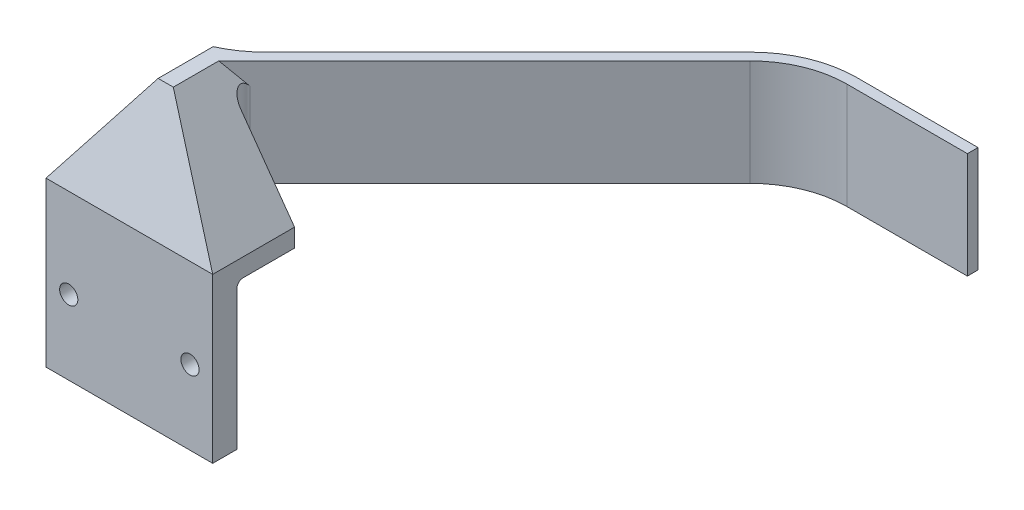
from build123d import *

# Parameters (mm, degrees)
SKETCH1_W           = 55
SKETCH1_H           = 48
SKETCH1_R           = 3
BOSS_EXTRUDE1_DEPTH = 8
SKETCH2_W           = 55
SKETCH2_H           = 27
BOSS_EXTRUDE2_DEPTH = 6
SKETCH3_W           = 15
SKETCH3_H           = 35
BOSS_EXTRUDE3_DEPTH = 2.5
FILLET1_R           = 2
RIB1_REACH          = 75.091
SKETCH4_WALL_W      = 185.181394164
SKETCH4_WALL_H      = 5
BOSS_EXTRUDE5_REACH = 77.566
BOSS_EXTRUDE6_DEPTH = 35
FILLET3_R           = 35
FILLET4_R           = 32
FILLET5_R           = 35
FILLET6_R           = 3


with BuildPart() as part:
    # Sketch1 → Boss-Extrude1 (new body)
    with BuildSketch(Plane.XY):
        Rectangle(SKETCH1_W, SKETCH1_H)
        with Locations((20, 0.5)):
            Circle(SKETCH1_R, mode=Mode.SUBTRACT)
        with Locations((-20, 0.5)):
            Circle(SKETCH1_R, mode=Mode.SUBTRACT)
    extrude(amount=BOSS_EXTRUDE1_DEPTH)

    # Sketch2 → Boss-Extrude2 (add)
    with BuildSketch(Plane(origin=(0, 24, 0), x_dir=(1, 0, 0), z_dir=(0, 1, 0))):
        with Locations((0, 5.5)):
            Rectangle(SKETCH2_W, SKETCH2_H)
    extrude(amount=BOSS_EXTRUDE2_DEPTH)

    # Sketch3 → Boss-Extrude3 (add, symmetric)
    with BuildSketch(Plane(origin=(0, 0, 0), x_dir=(0, 0, -1), z_dir=(1, 0, 0))):
        with Locations((11.5, 47.5)):
            Rectangle(SKETCH3_W, SKETCH3_H)
    extrude(amount=BOSS_EXTRUDE3_DEPTH, both=True)

    # Fillet1
    fillet1_edges = [part.edges().sort_by_distance(p)[0] for p in [
        (0, 24, 0),
    ]]
    fillet(fillet1_edges, radius=FILLET1_R)

    # Sketch4 wall → Rib1 (add, up to next)
    with BuildSketch(Plane(origin=(0, 47.5, 2), x_dir=(0, -0.945945945946, 0.324324324324), z_dir=(0, -0.324324324324, -0.945945945946)), mode=Mode.PRIVATE) as rib1_sk1:
        Rectangle(SKETCH4_WALL_W, SKETCH4_WALL_H)
    rib1_tool1 = extrude(rib1_sk1.sketch, amount=RIB1_REACH, mode=Mode.PRIVATE) - part.part
    add(rib1_tool1.solids().sort_by_distance((0, 47.5, 2))[0])

    # Boss-Extrude5: up to this plane
    boss_extrude5_end = Plane(origin=(0, 65, -4), z_dir=(0, 0.3243243243243244, 0.945945945945946))
    # Sketch5 → Boss-Extrude5 (add, up to the surface)
    with BuildSketch(Plane(origin=(0, 0, -19), x_dir=(-1, 0, 0), z_dir=(0, 0, -1)), mode=Mode.PRIVATE) as boss_extrude5_sk1:
        Polygon((-27.5, 30), (-2.5, 65), (-2.5, 30), align=None)
    boss_extrude5_tool1 = split(extrude(boss_extrude5_sk1.sketch, amount=-BOSS_EXTRUDE5_REACH, mode=Mode.PRIVATE), bisect_by=boss_extrude5_end, keep=Keep.BOTH, mode=Mode.PRIVATE)
    boss_extrude5 = boss_extrude5_tool1.solids().sort_by_distance((10.833333, 41.666667, -19))[0]
    add(boss_extrude5)

    # Mirror1: Boss-Extrude5 across plane
    add(boss_extrude5.mirror(Plane(origin=(0, 0, 0), x_dir=(0, 0, 1), z_dir=(1, 0, 0))))

    # Sketch7 → Boss-Extrude6 (add)
    with BuildSketch(Plane(origin=(0, 65, 0), x_dir=(1, 0, 0), z_dir=(0, 1, 0))):
        Polygon((2.5, 19), (-2.5, 19), (98, 119.5), (152.5, 119.5), (152.5, 116), (99.5, 116), align=None)
    extrude(amount=-BOSS_EXTRUDE6_DEPTH)

    # Fillet3
    fillet3_edges = [part.edges().sort_by_distance(p)[0] for p in [
        (98, 47.5, -119.5),
    ]]
    fillet(fillet3_edges, radius=FILLET3_R)

    # Fillet4
    fillet4_edges = [part.edges().sort_by_distance(p)[0] for p in [
        (99.5, 47.5, -116),
    ]]
    fillet(fillet4_edges, radius=FILLET4_R)

    # Fillet5
    fillet5_edges = [part.edges().sort_by_distance(p)[0] for p in [
        (-2.5, 47.5, -19),
    ]]
    fillet(fillet5_edges, radius=FILLET5_R)

    # Fillet6
    # the kernel refuses this fillet: 3 mm, written as the material it adds along each edge
    with BuildSketch(Plane(origin=(2.5, 65, -19), x_dir=(1, 0, 0), z_dir=(0, -1, 0))) as fillet6_piece_1_section:
        with BuildLine():
            CenterArc((FILLET6_R * 2.41421356237, -FILLET6_R), FILLET6_R, 90, 135)
            Line((FILLET6_R * 1.70710678119, -FILLET6_R * 1.70710678119), (0, 0))
            Line((0, 0), (FILLET6_R * 2.41421356237, 0))
        make_face()
    fillet6_piece_1 = extrude(amount=35, mode=Mode.PRIVATE)
    fillet6_piece_1 = split(fillet6_piece_1, bisect_by=Plane(origin=(12.87170443, 50.479613798, -20.318339623), z_dir=(-0.813733471206735, -0.5812381937190964, 0)), keep=Keep.TOP, mode=Mode.PRIVATE)
    add(fillet6_piece_1)


solid = part.part
